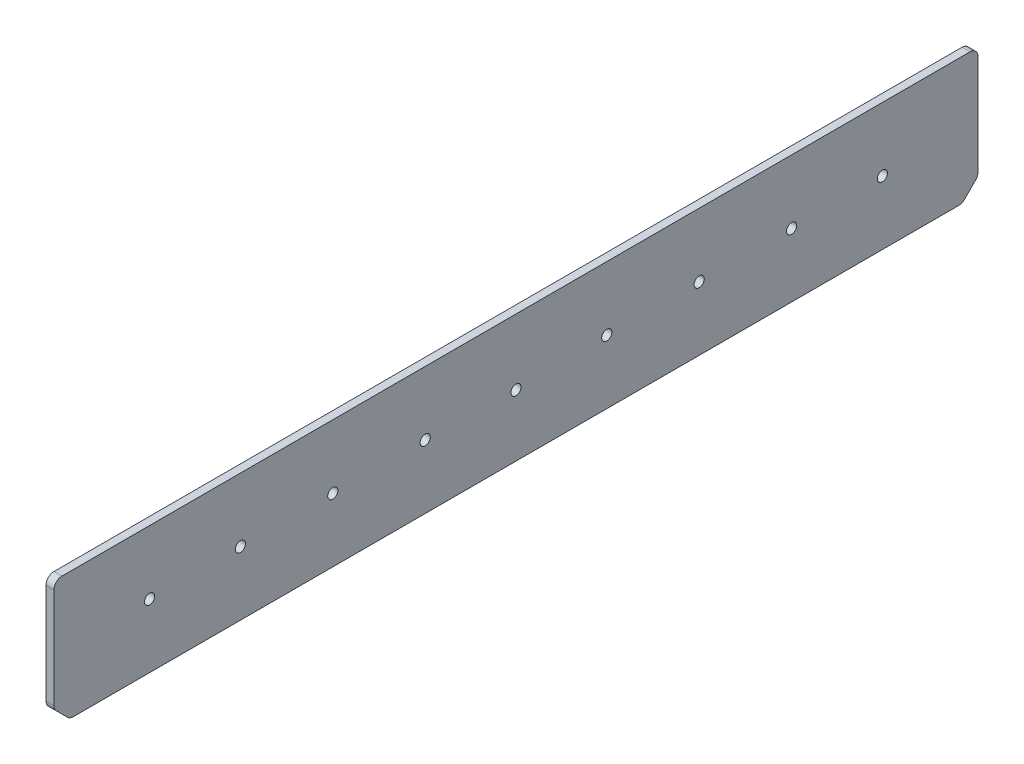
from build123d import *

# Parameters (mm, degrees)
SKETCH1_W           = 368.3
SKETCH1_H           = 50.8
BOSS_EXTRUDE1_DEPTH = 3.175
SKETCH2_R           = 2.032
CUT_EXTRUDE1_DEPTH  = 372.80049842
CHAMFER1_SIZE       = 6.35
FILLET1_R           = 3.175


with BuildPart() as part:
    # Sketch1 → Boss-Extrude1 (new body)
    with BuildSketch(Plane(origin=(0, 0, 0), x_dir=(0, 0, -1), z_dir=(1, 0, 0))):
        with Locations((184.15, 25.4)):
            Rectangle(SKETCH1_W, SKETCH1_H)
    extrude(amount=BOSS_EXTRUDE1_DEPTH)

    # Sketch2 → Cut-Extrude1 (cut, through all)
    with BuildSketch(Plane(origin=(3.175, 0, 0), x_dir=(0, 0, -1), z_dir=(1, 0, 0))):
        with Locations((330.191295554, 25.4)):
            Circle(SKETCH2_R)
        with Locations((184.15, 24.60625)):
            Circle(SKETCH2_R)
        with Locations((111.133704446, 25.4)):
            Circle(SKETCH2_R)
        with Locations((74.303704446, 25.4)):
            Circle(SKETCH2_R)
        with Locations((38.108704446, 25.4)):
            Circle(SKETCH2_R)
        with Locations((147.963704446, 25.4)):
            Circle(SKETCH2_R)
        with Locations((220.336295554, 25.4)):
            Circle(SKETCH2_R)
        with Locations((257.166295554, 25.4)):
            Circle(SKETCH2_R)
        with Locations((293.996295554, 25.4)):
            Circle(SKETCH2_R)
    extrude(amount=-CUT_EXTRUDE1_DEPTH, mode=Mode.SUBTRACT)

    # Chamfer1
    chamfer1_edges = [part.edges().sort_by_distance(p)[0] for p in [
        (1.5875, 0, 0),
        (1.5875, 0, -368.3),
    ]]
    chamfer(chamfer1_edges, length=CHAMFER1_SIZE)

    # Fillet1
    fillet1_edges = [part.edges().sort_by_distance(p)[0] for p in [
        (1.5875, 0, -361.95),
        (1.5875, 6.35, -368.3),
        (1.5875, 50.8, -368.3),
        (1.5875, 0, -6.35),
        (1.5875, 6.35, 0),
        (1.5875, 50.8, 0),
    ]]
    fillet(fillet1_edges, radius=FILLET1_R)


solid = part.part
